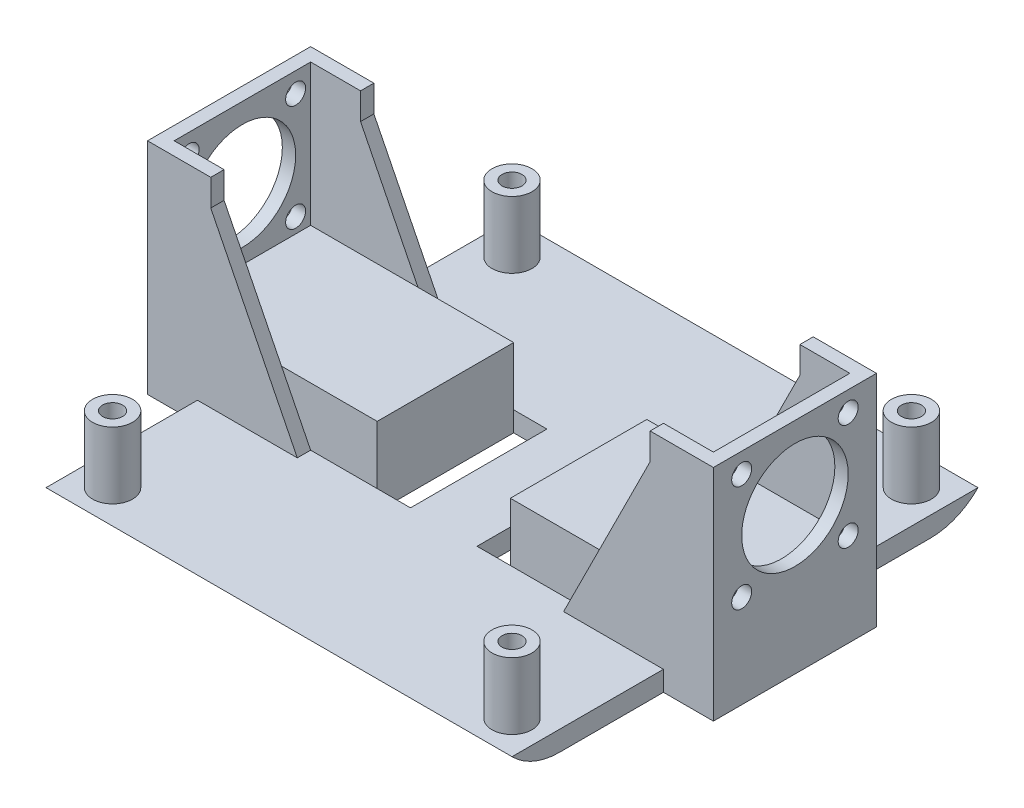
from build123d import *

# Parameters (mm, degrees)
SKETCH1_W                       = 70
SKETCH1_H                       = 70
BOSS_EXTRUDE1_DEPTH             = 3
SKETCH2_W                       = 7.5
SKETCH2_H                       = 20.5
BOSS_EXTRUDE2_DEPTH             = 3
SKETCH3_W                       = 2
SKETCH3_H                       = 20.5
BOSS_EXTRUDE3_DEPTH             = 30
CUT_EXTRUDE1_DEPTH              = 114.481275989
CUT_EXTRUDE1_DEPTH_BACK         = 114.481275989
SKETCH4_R                       = 8
SKETCH4_R_2                     = 1.5
BOSS_EXTRUDE4_REACH             = 110.657
SKETCH5_W                       = 9.5
SKETCH5_H                       = 2
BOSS_EXTRUDE4_DIRECTION_2_REACH = 110.657
BOSS_EXTRUDE5_REACH             = 98.581
SKETCH7_W                       = 81
SKETCH7_H                       = 20.5
CUT_EXTRUDE2_DEPTH              = 109.656569061
SKETCH8_W                       = 5
SKETCH8_H                       = 20.5
CUT_EXTRUDE3_DEPTH              = 109.656569061
BOSS_EXTRUDE7_REACH             = 115.481
SKETCH17_W                      = 20.5
SKETCH17_H                      = 8.75
BOSS_EXTRUDE8_DEPTH             = 30.5
SKETCH19_R                      = 3
BOSS_EXTRUDE9_DEPTH             = 10
SKETCH20_R                      = 1.5
CUT_EXTRUDE4_DEPTH              = 107.330851591
FILLET1_DEPTH                   = 70


with BuildPart() as part:
    # Sketch1 → Boss-Extrude1 (new body)
    with BuildSketch(Plane(origin=(0, 0, 0), x_dir=(1, 0, 0), z_dir=(0, 1, 0))):
        with Locations((35, 35)):
            Rectangle(SKETCH1_W, SKETCH1_H)
    extrude(amount=BOSS_EXTRUDE1_DEPTH)

    # Sketch2 → Boss-Extrude2 (add)
    with BuildSketch(Plane(origin=(0, 3, 0), x_dir=(1, 0, 0), z_dir=(0, 1, 0))):
        with Locations((-3.75, 35)):
            Rectangle(SKETCH2_W, SKETCH2_H)
        with Locations((73.75, 35)):
            Rectangle(SKETCH2_W, SKETCH2_H)
    extrude(amount=-BOSS_EXTRUDE2_DEPTH)

    # Sketch3 → Boss-Extrude3 (add)
    with BuildSketch(Plane(origin=(0, 3, 0), x_dir=(1, 0, 0), z_dir=(0, 1, 0))):
        with Locations((-6.5, 35)):
            Rectangle(SKETCH3_W, SKETCH3_H)
        with Locations((76.5, 35)):
            Rectangle(SKETCH3_W, SKETCH3_H)
    extrude(amount=BOSS_EXTRUDE3_DEPTH)

    # Sketch4 → Cut-Extrude1 (cut, two sides: drawn at the far end of the back side and taken through both)
    with BuildSketch(Plane(origin=(-5.5, 0, 0), x_dir=(0, 0, -1), z_dir=(1, 0, 0)).offset(-CUT_EXTRUDE1_DEPTH_BACK)):
        with Locations((35, 22)):
            Circle(SKETCH4_R)
        with Locations((43, 30)):
            Circle(SKETCH4_R_2)
        with Locations((43, 14)):
            Circle(SKETCH4_R_2)
        with Locations((27, 30)):
            Circle(SKETCH4_R_2)
        with Locations((27, 14)):
            Circle(SKETCH4_R_2)
    extrude(amount=CUT_EXTRUDE1_DEPTH + CUT_EXTRUDE1_DEPTH_BACK, mode=Mode.SUBTRACT)

    # Boss-Extrude4: up to this face of the body (flat: up to its plane)
    boss_extrude4_end = Plane(part.part.faces().sort_by_distance((35, 0, -35))[0])
    # Sketch5 → Boss-Extrude4 (add, up to the picked face)
    with BuildSketch(Plane(origin=(0, 3, 0), x_dir=(1, 0, 0), z_dir=(0, 1, 0)), mode=Mode.PRIVATE) as boss_extrude4_sk1:
        with Locations((-2.75, 23.75)):
            Rectangle(SKETCH5_W, SKETCH5_H)
    boss_extrude4_tool1 = split(extrude(boss_extrude4_sk1.sketch, amount=-BOSS_EXTRUDE4_REACH, mode=Mode.PRIVATE), bisect_by=boss_extrude4_end, keep=Keep.BOTH, mode=Mode.PRIVATE)
    # Sketch5 → Boss-Extrude4 (add, up to the picked face)
    with BuildSketch(Plane(origin=(0, 3, 0), x_dir=(1, 0, 0), z_dir=(0, 1, 0)), mode=Mode.PRIVATE) as boss_extrude4_sk2:
        with Locations((-2.75, 46.25)):
            Rectangle(SKETCH5_W, SKETCH5_H)
    boss_extrude4_tool2 = split(extrude(boss_extrude4_sk2.sketch, amount=-BOSS_EXTRUDE4_REACH, mode=Mode.PRIVATE), bisect_by=boss_extrude4_end, keep=Keep.BOTH, mode=Mode.PRIVATE)
    # Sketch5 → Boss-Extrude4 (add, up to the picked face)
    with BuildSketch(Plane(origin=(0, 3, 0), x_dir=(1, 0, 0), z_dir=(0, 1, 0)), mode=Mode.PRIVATE) as boss_extrude4_sk3:
        with Locations((72.75, 23.75)):
            Rectangle(SKETCH5_W, SKETCH5_H)
    boss_extrude4_tool3 = split(extrude(boss_extrude4_sk3.sketch, amount=-BOSS_EXTRUDE4_REACH, mode=Mode.PRIVATE), bisect_by=boss_extrude4_end, keep=Keep.BOTH, mode=Mode.PRIVATE)
    # Sketch5 → Boss-Extrude4 (add, up to the picked face)
    with BuildSketch(Plane(origin=(0, 3, 0), x_dir=(1, 0, 0), z_dir=(0, 1, 0)), mode=Mode.PRIVATE) as boss_extrude4_sk4:
        with Locations((72.75, 46.25)):
            Rectangle(SKETCH5_W, SKETCH5_H)
    boss_extrude4_tool4 = split(extrude(boss_extrude4_sk4.sketch, amount=-BOSS_EXTRUDE4_REACH, mode=Mode.PRIVATE), bisect_by=boss_extrude4_end, keep=Keep.BOTH, mode=Mode.PRIVATE)
    add(boss_extrude4_tool1.solids().sort_by(Axis((-2.75, 3, -23.75), (0, -1, 0)))[0])
    add(boss_extrude4_tool2.solids().sort_by(Axis((-2.75, 3, -46.25), (0, -1, 0)))[0])
    add(boss_extrude4_tool3.solids().sort_by(Axis((72.75, 3, -23.75), (0, -1, 0)))[0])
    add(boss_extrude4_tool4.solids().sort_by(Axis((72.75, 3, -46.25), (0, -1, 0)))[0])

    # Boss-Extrude4 direction 2: up to this face of the body (flat: up to its plane)
    boss_extrude4_direction_2_end = Plane(part.part.faces().sort_by_distance((76.5, 33, -35))[0])
    # Sketch5 → Boss-Extrude4 direction 2 (add, up to the picked face)
    with BuildSketch(Plane(origin=(0, 3, 0), x_dir=(1, 0, 0), z_dir=(0, 1, 0)), mode=Mode.PRIVATE) as boss_extrude4_direction_2_sk1:
        with Locations((-2.75, 23.75)):
            Rectangle(SKETCH5_W, SKETCH5_H)
    boss_extrude4_direction_2_tool1 = split(extrude(boss_extrude4_direction_2_sk1.sketch, amount=BOSS_EXTRUDE4_DIRECTION_2_REACH, mode=Mode.PRIVATE), bisect_by=boss_extrude4_direction_2_end, keep=Keep.BOTH, mode=Mode.PRIVATE)
    # Sketch5 → Boss-Extrude4 direction 2 (add, up to the picked face)
    with BuildSketch(Plane(origin=(0, 3, 0), x_dir=(1, 0, 0), z_dir=(0, 1, 0)), mode=Mode.PRIVATE) as boss_extrude4_direction_2_sk2:
        with Locations((-2.75, 46.25)):
            Rectangle(SKETCH5_W, SKETCH5_H)
    boss_extrude4_direction_2_tool2 = split(extrude(boss_extrude4_direction_2_sk2.sketch, amount=BOSS_EXTRUDE4_DIRECTION_2_REACH, mode=Mode.PRIVATE), bisect_by=boss_extrude4_direction_2_end, keep=Keep.BOTH, mode=Mode.PRIVATE)
    # Sketch5 → Boss-Extrude4 direction 2 (add, up to the picked face)
    with BuildSketch(Plane(origin=(0, 3, 0), x_dir=(1, 0, 0), z_dir=(0, 1, 0)), mode=Mode.PRIVATE) as boss_extrude4_direction_2_sk3:
        with Locations((72.75, 23.75)):
            Rectangle(SKETCH5_W, SKETCH5_H)
    boss_extrude4_direction_2_tool3 = split(extrude(boss_extrude4_direction_2_sk3.sketch, amount=BOSS_EXTRUDE4_DIRECTION_2_REACH, mode=Mode.PRIVATE), bisect_by=boss_extrude4_direction_2_end, keep=Keep.BOTH, mode=Mode.PRIVATE)
    # Sketch5 → Boss-Extrude4 direction 2 (add, up to the picked face)
    with BuildSketch(Plane(origin=(0, 3, 0), x_dir=(1, 0, 0), z_dir=(0, 1, 0)), mode=Mode.PRIVATE) as boss_extrude4_direction_2_sk4:
        with Locations((72.75, 46.25)):
            Rectangle(SKETCH5_W, SKETCH5_H)
    boss_extrude4_direction_2_tool4 = split(extrude(boss_extrude4_direction_2_sk4.sketch, amount=BOSS_EXTRUDE4_DIRECTION_2_REACH, mode=Mode.PRIVATE), bisect_by=boss_extrude4_direction_2_end, keep=Keep.BOTH, mode=Mode.PRIVATE)
    add(boss_extrude4_direction_2_tool1.solids().sort_by(Axis((-2.75, 3, -23.75), (0, 1, 0)))[0])
    add(boss_extrude4_direction_2_tool2.solids().sort_by(Axis((-2.75, 3, -46.25), (0, 1, 0)))[0])
    add(boss_extrude4_direction_2_tool3.solids().sort_by(Axis((72.75, 3, -23.75), (0, 1, 0)))[0])
    add(boss_extrude4_direction_2_tool4.solids().sort_by(Axis((72.75, 3, -46.25), (0, 1, 0)))[0])

    # Boss-Extrude5: up to this face of the body (flat: up to its plane)
    boss_extrude5_end = Plane(part.part.faces().sort_by_distance((72.823170732, 16.792682927, -22.75))[0])
    # Sketch6 → Boss-Extrude5 (add, up to the picked face)
    with BuildSketch(Plane(origin=(0, 0, -47.25), x_dir=(-1, 0, 0), z_dir=(0, 0, -1)), mode=Mode.PRIVATE) as boss_extrude5_sk1:
        Polygon((-70, 33), (-55, 3), (-70, 3), align=None)
    boss_extrude5_tool1 = split(extrude(boss_extrude5_sk1.sketch, amount=-BOSS_EXTRUDE5_REACH, mode=Mode.PRIVATE), bisect_by=boss_extrude5_end, keep=Keep.BOTH, mode=Mode.PRIVATE)
    # Sketch6 → Boss-Extrude5 (add, up to the picked face)
    with BuildSketch(Plane(origin=(0, 0, -47.25), x_dir=(-1, 0, 0), z_dir=(0, 0, -1)), mode=Mode.PRIVATE) as boss_extrude5_sk2:
        Polygon((0, 33), (-15, 3), (0, 3), align=None)
    boss_extrude5_tool2 = split(extrude(boss_extrude5_sk2.sketch, amount=-BOSS_EXTRUDE5_REACH, mode=Mode.PRIVATE), bisect_by=boss_extrude5_end, keep=Keep.BOTH, mode=Mode.PRIVATE)
    add(boss_extrude5_tool1.solids().sort_by(Axis((65, 13, -47.25), (0, 0, 1)))[0])
    add(boss_extrude5_tool2.solids().sort_by(Axis((5, 13, -47.25), (0, 0, 1)))[0])

    # Sketch7 → Cut-Extrude2 (cut, through all)
    with BuildSketch(Plane(origin=(0, 3, 0), x_dir=(1, 0, 0), z_dir=(0, 1, 0))):
        with Locations((35, 35)):
            Rectangle(SKETCH7_W, SKETCH7_H)
    extrude(amount=CUT_EXTRUDE2_DEPTH, mode=Mode.SUBTRACT)

    # Sketch8 → Cut-Extrude3 (cut, through all)
    with BuildSketch(Plane(origin=(0, 3, 0), x_dir=(1, 0, 0), z_dir=(0, 1, 0))):
        with Locations((27.5, 35)):
            Rectangle(SKETCH8_W, SKETCH8_H)
        with Locations((42.5, 35)):
            Rectangle(SKETCH8_W, SKETCH8_H)
    extrude(amount=-CUT_EXTRUDE3_DEPTH, mode=Mode.SUBTRACT)

    # Boss-Extrude7: up to this face of the body (flat: up to its plane)
    boss_extrude7_end = Plane(part.part.faces().sort_by_distance((45, 1.5, -35))[0])
    # Sketch17 → Boss-Extrude7 (add, up to the picked face)
    with BuildSketch(Plane.ZY.offset(-75.5), mode=Mode.PRIVATE) as boss_extrude7_sk1:
        with Locations((-35, 7.375)):
            Rectangle(SKETCH17_W, SKETCH17_H)
    boss_extrude7_tool1 = split(extrude(boss_extrude7_sk1.sketch, amount=BOSS_EXTRUDE7_REACH, mode=Mode.PRIVATE), bisect_by=boss_extrude7_end, keep=Keep.BOTH, mode=Mode.PRIVATE)
    add(boss_extrude7_tool1.solids().sort_by(Axis((75.5, 7.375, -35), (-1, 0, 0)))[0])

    # Sketch18 → Boss-Extrude8 (add)
    with BuildSketch(Plane(origin=(-5.5, 0, 0), x_dir=(0, 0, -1), z_dir=(1, 0, 0))):
        Polygon((24.75, 3), (24.75, 0), (45.25, 0), (45.25, 3), (45.25, 11.75), (24.75, 11.75), align=None)
    extrude(amount=BOSS_EXTRUDE8_DEPTH)

    # Sketch19 → Boss-Extrude9 (add)
    with BuildSketch(Plane(origin=(0, 3, 0), x_dir=(1, 0, 0), z_dir=(0, 1, 0))):
        with Locations(Location((5, 5, 0), (0, 0, 90))):
            Circle(SKETCH19_R)
        with Locations(Location((65, 5, 0), (0, 0, 90))):
            Circle(SKETCH19_R)
        with Locations(Location((65, 65, 0), (0, 0, 90))):
            Circle(SKETCH19_R)
        with Locations(Location((5, 65, 0), (0, 0, 90))):
            Circle(SKETCH19_R)
    extrude(amount=BOSS_EXTRUDE9_DEPTH)

    # Sketch20 → Cut-Extrude4 (cut, through all)
    with BuildSketch(Plane(origin=(0, 13, 0), x_dir=(1, 0, 0), z_dir=(0, 1, 0))):
        with Locations(Location((5, 65, 0), (0, 0, 270))):
            Circle(SKETCH20_R)
        with Locations(Location((65, 65, 0), (0, 0, 270))):
            Circle(SKETCH20_R)
        with Locations(Location((65, 5, 0), (0, 0, 270))):
            Circle(SKETCH20_R)
        with Locations(Location((5, 5, 0), (0, 0, 270))):
            Circle(SKETCH20_R)
    extrude(amount=-CUT_EXTRUDE4_DEPTH, mode=Mode.SUBTRACT)

    # Fillet1: read off the stored shape, not the designer's step
    # Fillet1 outline → Fillet1 (cut)
    with BuildSketch(Plane.YZ):
        with BuildLine():
            Line((0, 0), (0, -7.141428429))
            ThreePointArc((0, -7.141428429), (0.780455543, -3.268445083), (3, 0))
            Line((3, 0), (0, 0))
        make_face()
        with BuildLine():
            ThreePointArc((3, -70), (0.780455543, -66.731554917), (0, -62.858571571))
            Line((0, -62.858571571), (0, -70))
            Line((0, -70), (3, -70))
        make_face()
    extrude(amount=FILLET1_DEPTH, mode=Mode.SUBTRACT)


solid = part.part
